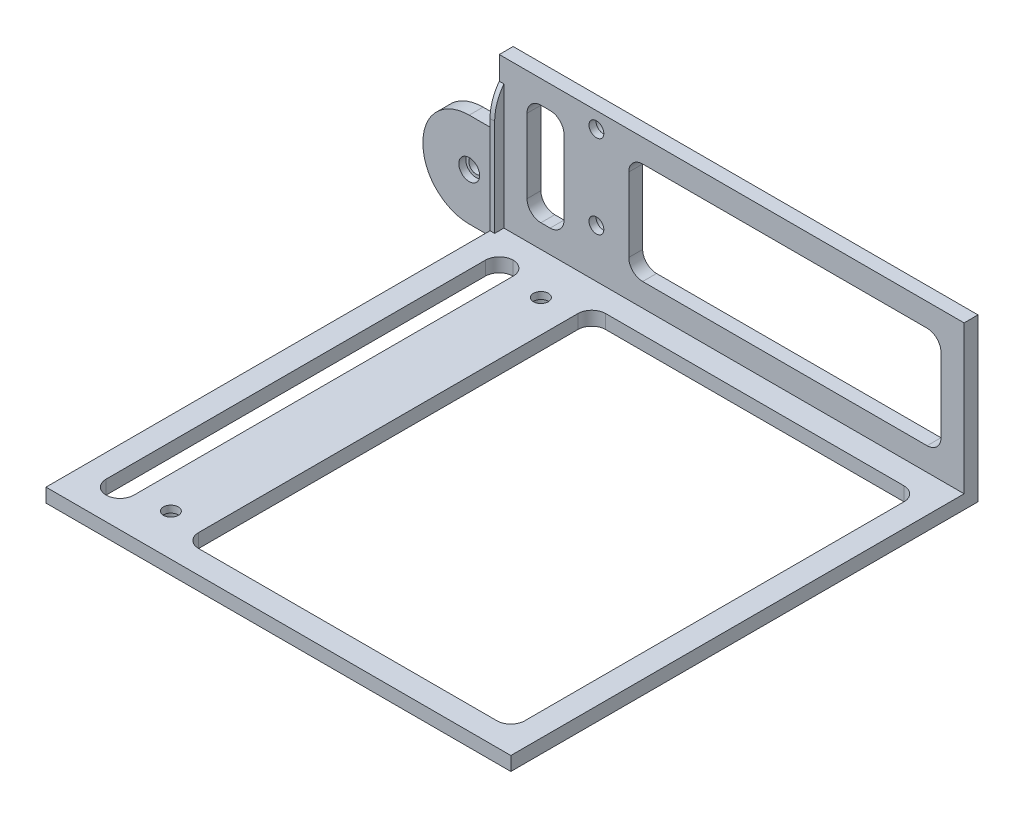
from build123d import *

# Parameters (mm, degrees)
SKETCH1_R           = 1.6
SKETCH1_W           = 1
SKETCH1_H           = 27
BOSS_EXTRUDE1_DEPTH = 3
SKETCH1_3_W         = 1
SKETCH1_3_H         = 27
BOSS_EXTRUDE2_DEPTH = 5
BOSS_EXTRUDE3_DEPTH = 101
SKETCH2_R           = 2.25
CUT_EXTRUDE1_DEPTH  = 1.5
SKETCH4_R           = 2.25
CUT_EXTRUDE2_DEPTH  = 1.5
SKETCH5_R           = 1.6
CUT_EXTRUDE3_DEPTH  = 3
SKETCH6_R           = 2.25
CUT_EXTRUDE4_DEPTH  = 1.5
SKETCH7_W           = 16.5
SKETCH7_H           = 98
CUT_EXTRUDE5_DEPTH  = 3
SKETCH8_W           = 16.5
SKETCH8_H           = 14.6
CUT_EXTRUDE6_DEPTH  = 3
FILLET1_R           = 10
FILLET2_R           = 10
FILLET3_R           = 10
SKETCH9_W           = 67.5
SKETCH9_H           = 22
SKETCH9_W_2         = 8
CUT_EXTRUDE7_DEPTH  = 10
FILLET4_R           = 3
SKETCH10_W          = 70.5
SKETCH10_H          = 88
SKETCH10_W_2        = 6
CUT_EXTRUDE8_DEPTH  = 10
FILLET5_R           = 3


# Some blends are built 0.0001 mm under size
with BuildPart() as part:
    # Sketch1 → Boss-Extrude1 (new body)
    # profile 1 of 3: a face of its own
    with BuildSketch(Plane.XY):
        Polygon((0, 3), (0, 0), (117, 0), (117, 3), (17.5, 3), (16.5, 3), align=None)
    # profile 2 of 3: a face of its own
    with BuildSketch(Plane.XY):
        Polygon((0, 35), (0, 3), (16.5, 3), (16.5, 30), (17.5, 30), (17.5, 3), (117, 3), (117, 35), align=None)
        with Locations((10, 10.2)):
            Circle(SKETCH1_R, mode=Mode.SUBTRACT)
        with Locations((37.5, 13.5)):
            Circle(SKETCH1_R, mode=Mode.SUBTRACT)
        with Locations((37.5, 31.5)):
            Circle(SKETCH1_R, mode=Mode.SUBTRACT)
    # profile 3 of 3: a face of its own
    with BuildSketch(Plane.XY):
        with Locations((17, 16.5)):
            Rectangle(SKETCH1_W, SKETCH1_H)
    extrude(amount=BOSS_EXTRUDE1_DEPTH)

    # Sketch1<3> → Boss-Extrude2 (add)
    with BuildSketch(Plane.XY):
        with Locations((17, 16.5)):
            Rectangle(SKETCH1_3_W, SKETCH1_3_H)
    extrude(amount=BOSS_EXTRUDE2_DEPTH)

    # Sketch1<7> → Boss-Extrude3 (add)
    with BuildSketch(Plane.XY):
        Polygon((0, 3), (0, 0), (117, 0), (117, 3), (17.5, 3), (16.5, 3), align=None)
    extrude(amount=BOSS_EXTRUDE3_DEPTH)

    # Sketch2 → Cut-Extrude1 (cut)
    with BuildSketch(Plane(origin=(0, 0, 0), x_dir=(-1, 0, 0), z_dir=(0, 0, -1))):
        with Locations((-37.5, 31.5)):
            Circle(SKETCH2_R)
        with Locations((-37.5, 13.5)):
            Circle(SKETCH2_R)
    extrude(amount=-CUT_EXTRUDE1_DEPTH, mode=Mode.SUBTRACT)

    # Sketch4 → Cut-Extrude2 (cut)
    with BuildSketch(Plane.XY.offset(3)):
        with Locations((10, 10.2)):
            Circle(SKETCH4_R)
    extrude(amount=-CUT_EXTRUDE2_DEPTH, mode=Mode.SUBTRACT)

    # Sketch5 → Cut-Extrude3 (cut)
    with BuildSketch(Plane(origin=(0, 3, 0), x_dir=(1, 0, 0), z_dir=(0, 1, 0))):
        with Locations(Location((34.5, -12, 0), (0, 0, 270))):
            Circle(SKETCH5_R)
        with Locations(Location((34.5, -92, 0), (0, 0, 270))):
            Circle(SKETCH5_R)
    extrude(amount=-CUT_EXTRUDE3_DEPTH, mode=Mode.SUBTRACT)

    # Sketch6 → Cut-Extrude4 (cut)
    with BuildSketch(Plane.XZ):
        with Locations(Location((34.5, 92, 0), (0, 0, 270))):
            Circle(SKETCH6_R)
        with Locations(Location((34.5, 12, 0), (0, 0, 270))):
            Circle(SKETCH6_R)
    extrude(amount=-CUT_EXTRUDE4_DEPTH, mode=Mode.SUBTRACT)

    # Sketch7 → Cut-Extrude5 (cut)
    with BuildSketch(Plane(origin=(0, 3, 0), x_dir=(1, 0, 0), z_dir=(0, 1, 0))):
        with Locations((8.25, -52)):
            Rectangle(SKETCH7_W, SKETCH7_H)
    extrude(amount=-CUT_EXTRUDE5_DEPTH, mode=Mode.SUBTRACT)

    # Sketch8 → Cut-Extrude6 (cut)
    with BuildSketch(Plane.XY.offset(3)):
        with Locations((8.25, 27.7)):
            Rectangle(SKETCH8_W, SKETCH8_H)
    extrude(amount=-CUT_EXTRUDE6_DEPTH, mode=Mode.SUBTRACT)

    # Fillet1
    fillet1_edges = [part.edges().sort_by_distance(p)[0] for p in [
        (0, 20.4, 1.5),
    ]]
    fillet(fillet1_edges, radius=FILLET1_R)

    # Fillet2
    fillet2_edges = [part.edges().sort_by_distance(p)[0] for p in [
        (0, 0, 1.5),
    ]]
    fillet(fillet2_edges, radius=FILLET2_R)

    # Fillet3
    # the kernel refuses this fillet: 10 mm, written as the material it takes off along each edge
    with BuildSketch(Plane(origin=(1.5, 30, 5), x_dir=(0, 0, -1), z_dir=(1, 0, 0))) as fillet3_piece_1:
        with BuildLine():
            CenterArc((10, -6), FILLET3_R, 143.130102354, 36.869897646)
            Line((0, -6), (-0.2, -6))
            Line((-0.2, -6), (-0.2, 0))
            Line((-0.2, 0), (0, 0.2))
            ThreePointArc((0, 0.2), (1, 0.2), (1.84, 0.12))
            Line((1.84, 0.12), (2, 0))
        make_face()
    extrude(amount=31, mode=Mode.SUBTRACT)

    # Sketch9 → Cut-Extrude7 (cut)
    with BuildSketch(Plane.XY.offset(3)):
        with Locations((78.25, 19)):
            Rectangle(SKETCH9_W, SKETCH9_H)
        with Locations((26.5, 19)):
            Rectangle(SKETCH9_W_2, SKETCH9_H)
    extrude(amount=-CUT_EXTRUDE7_DEPTH, mode=Mode.SUBTRACT)

    # Fillet4
    fillet4_edges = [part.edges().sort_by_distance(p)[0] for p in [
        (44.5, 8, 1.5),
        (44.5, 30, 1.5),
        (112, 30, 1.5),
        (112, 8, 1.5),
        (22.5, 8, 1.5),
        (22.5, 30, 1.5),
        (30.5, 30, 1.5),
        (30.5, 8, 1.5),
    ]]
    fillet(fillet4_edges, radius=FILLET4_R)

    # Sketch10 → Cut-Extrude8 (cut)
    with BuildSketch(Plane(origin=(0, 3, 0), x_dir=(1, 0, 0), z_dir=(0, 1, 0))):
        with Locations((76.75, -52)):
            Rectangle(SKETCH10_W, SKETCH10_H)
        with Locations((24.5, -52)):
            Rectangle(SKETCH10_W_2, SKETCH10_H)
    extrude(amount=-CUT_EXTRUDE8_DEPTH, mode=Mode.SUBTRACT)

    # Fillet5
    fillet5_edges = [part.edges().sort_by_distance(p)[0] for p in [
        (41.5, 1.5, 96),
        (41.5, 1.5, 8),
        (112, 1.5, 8),
        (112, 1.5, 96),
        (21.5, 1.5, 96),
        (21.5, 1.5, 8),
        (27.5, 1.5, 8),
        (27.5, 1.5, 96),
    ]]
    fillet(fillet5_edges, radius=FILLET5_R - 0.0001)  # a hair under: the kernel refuses the full size


solid = part.part
